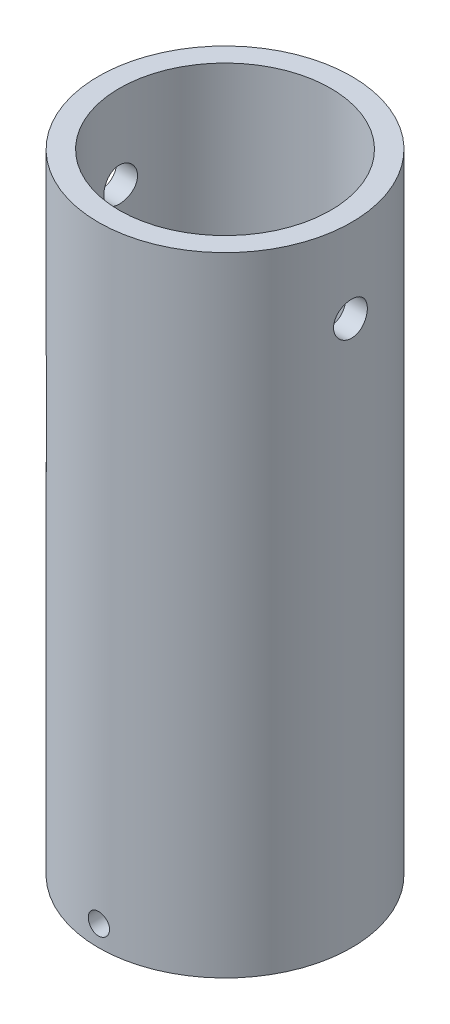
from build123d import *

# Parameters (mm, degrees)
SKETCH1_R               = 30.35
BOSS_EXTRUDE1_DEPTH     = 10
SKETCH2_R               = 30.35
BOSS_EXTRUDE2_DEPTH     = 140.65
SKETCH4_R               = 25.35
CUT_EXTRUDE1_DEPTH      = 308.65
SKETCH6_R               = 2.55
CUT_EXTRUDE3_DEPTH      = 90
CUT_EXTRUDE4_START      = -6
CUT_EXTRUDE4_DEPTH      = 7
CUT_EXTRUDE5_DEPTH      = 10
CUT_EXTRUDE6_DEPTH      = 137
CUT_EXTRUDE6_DEPTH_BACK = 137
SKETCH10_R              = 4.05


with BuildPart() as part:
    # Sketch1 → Boss-Extrude1 (new body)
    with BuildSketch(Plane(origin=(0, 0, 0), x_dir=(1, 0, 0), z_dir=(0, 1, 0))):
        with Locations(Location((0, 0, 0), (0, 0, 270))):
            Circle(SKETCH1_R)
    extrude(amount=BOSS_EXTRUDE1_DEPTH)

    # Sketch2 → Boss-Extrude2 (add)
    with BuildSketch(Plane(origin=(0, 10, 0), x_dir=(1, 0, 0), z_dir=(0, 1, 0))):
        with Locations(Location((0, 0, 0), (0, 0, 270))):
            Circle(SKETCH2_R)
    extrude(amount=BOSS_EXTRUDE2_DEPTH)

    # Sketch4 → Cut-Extrude1 (cut)
    with BuildSketch(Plane(origin=(0, 150.65, 0), x_dir=(1, 0, 0), z_dir=(0, 1, 0))):
        with Locations(Location((0, 0, 0), (0, 0, 270))):
            Circle(SKETCH4_R)
    extrude(amount=-CUT_EXTRUDE1_DEPTH, mode=Mode.SUBTRACT)

    # Sketch6 → Cut-Extrude3 (cut)
    with BuildSketch(Plane(origin=(0, 0, -30.35), x_dir=(-1, 0, 0), z_dir=(0, 0, -1))):
        with Locations((0, 5)):
            Circle(SKETCH6_R)
    extrude(amount=-CUT_EXTRUDE3_DEPTH, mode=Mode.SUBTRACT)

    # Cut-Extrude4: read off the stored shape, not the designer's step
    # Cut-Extrude4 outline → Cut-Extrude4 (cut)
    with BuildSketch(Plane(origin=(-21.460690809, 0, -21.460690809), x_dir=(0, -1, 0), z_dir=(-0.7071067811865417, 0, -0.7071067811865533)).offset(CUT_EXTRUDE4_START)):
        with BuildLine():
            ThreePointArc((-106.74, 2.55), (-109.29, 0), (-106.74, -2.55))
            Line((-106.74, -2.55), (-86.74, -2.55))
            ThreePointArc((-86.74, -2.55), (-84.19, 0), (-86.74, 2.55))
            Line((-86.74, 2.55), (-106.74, 2.55))
        make_face()
    extrude(amount=CUT_EXTRUDE4_DEPTH, mode=Mode.SUBTRACT)

    # Sketch9 → Cut-Extrude5 (cut)
    with BuildSketch(Plane(origin=(-21.460690809, 0, 21.460690809), x_dir=(0, -1, 0), z_dir=(-0.7071067811865512, 0, 0.7071067811865438))):
        with BuildLine():
            Line((-86.74, 2.55), (-106.74, 2.55))
            ThreePointArc((-106.74, 2.55), (-109.29, 0), (-106.74, -2.55))
            Line((-106.74, -2.55), (-86.74, -2.55))
            ThreePointArc((-86.74, -2.55), (-84.19, 0), (-86.74, 2.55))
        make_face()
    extrude(amount=-CUT_EXTRUDE5_DEPTH, mode=Mode.SUBTRACT)

    # Sketch10 → Cut-Extrude6 (cut, two sides: drawn at the far end of the back side and taken through both)
    with BuildSketch(Plane(origin=(0, 0, 0), x_dir=(0, 0, -1), z_dir=(1, 0, 0)).offset(-CUT_EXTRUDE6_DEPTH_BACK)):
        with Locations(Location((0, 130.65, 0), (0, 0, 180))):
            Circle(SKETCH10_R)
    extrude(amount=CUT_EXTRUDE6_DEPTH + CUT_EXTRUDE6_DEPTH_BACK, mode=Mode.SUBTRACT)


solid = part.part
